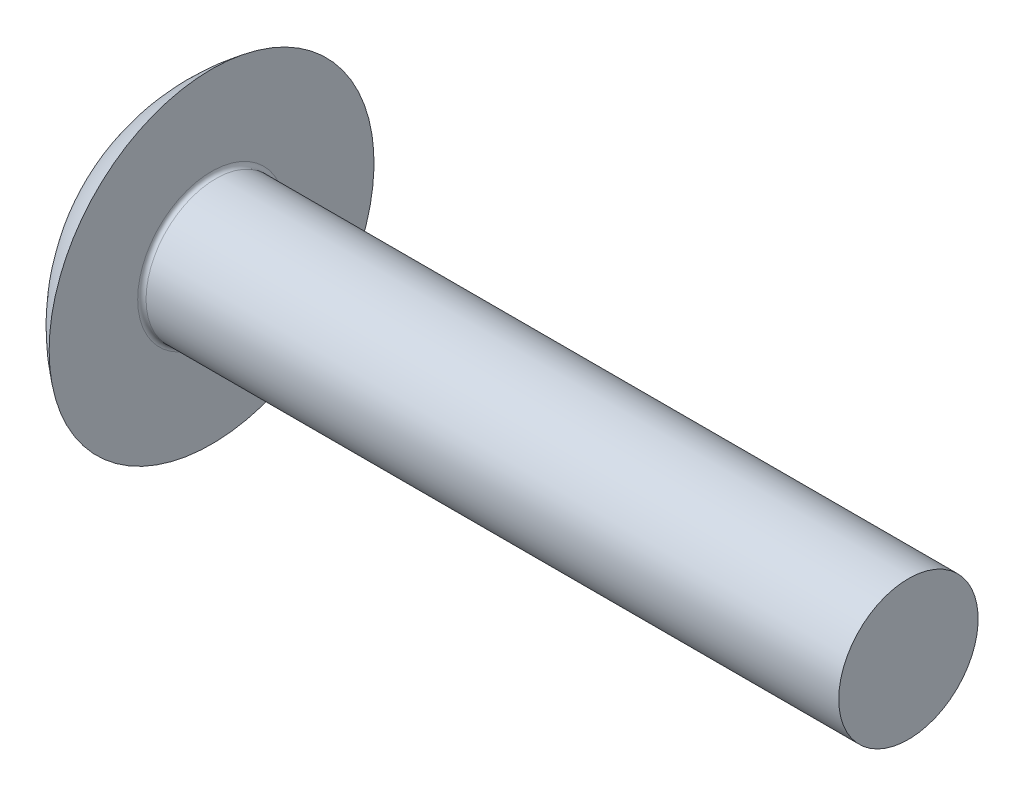
from build123d import *

# Parameters (mm, degrees)
FILLET1_R = 0.3


with BuildPart() as part:
    # Sketch1 → Base-Revolve (revolve)
    with BuildSketch(Plane.XY):
        with BuildLine():
            Line((55.873347501, 0), (55.873347501, 5))
            Line((55.873347501, 5), (5.873347501, 5))
            Line((5.873347501, 5), (5.873347501, 11.654650002))
            ThreePointArc((5.873347501, 11.654650002), (1.55132321, 6.525470817), (0, 0))
            Line((0, 0), (55.873347501, 0))
        make_face()
    revolve(axis=Axis((-81.166480447, 0, 0), (1, 0, 0)))

    # Fillet1
    fillet1_edges = [part.edges().sort_by_distance(p)[0] for p in [
        (5.873347501, -5, 0),
    ]]
    fillet(fillet1_edges, radius=FILLET1_R)


solid = part.part
